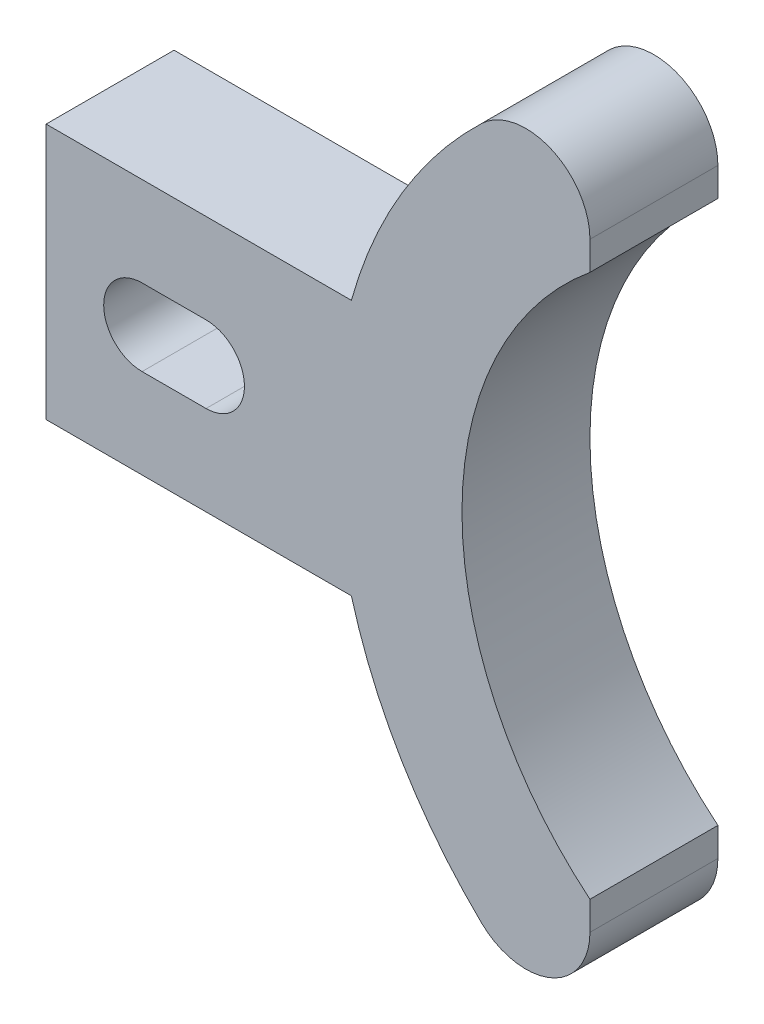
from build123d import *

# Parameters (mm, degrees)
SKETCH1_R           = 3.81
BOSS_EXTRUDE1_DEPTH = 12.7
SKETCH5_W           = 136.177702976
SKETCH5_H           = 134.894748865
CUT_EXTRUDE2_DEPTH  = 82.624584925
FILLET2_R           = 6.35
CUT_EXTRUDE3_DEPTH  = 74.887508158


with BuildPart() as part:
    # Sketch1 → Boss-Extrude1 (new body)
    with BuildSketch(Plane.XY):
        with BuildLine():
            Line((0, 25.4), (0, 0))
            Line((0, 0), (30.299557464, 0))
            ThreePointArc((30.299557464, 0), (44.893679727, -23.189482247), (69.85, -34.499768273))
            Line((69.85, -34.499768273), (69.85, -21.642875899))
            ThreePointArc((69.85, -21.642875899), (41.275, 12.7), (69.85, 47.042875899))
            Line((69.85, 47.042875899), (69.85, 59.899768273))
            ThreePointArc((69.85, 59.899768273), (44.893679727, 48.589482247), (30.299557464, 25.4))
            Line((30.299557464, 25.4), (0, 25.4))
        make_face()
        with Locations((12.7, 12.7)):
            Circle(SKETCH1_R, mode=Mode.SUBTRACT)
    extrude(amount=BOSS_EXTRUDE1_DEPTH)

    # Sketch5 → Cut-Extrude2 (cut, through all)
    with BuildSketch(Plane(origin=(53.975, 0, 0), x_dir=(0, 0, -1), z_dir=(1, 0, 0))):
        with Locations((5.326430662, 6.052825646)):
            Rectangle(SKETCH5_W, SKETCH5_H)
    extrude(amount=CUT_EXTRUDE2_DEPTH, mode=Mode.SUBTRACT)

    # Fillet2
    fillet2_edges = [part.edges().sort_by_distance(p)[0] for p in [
        (53.975, -29.421134838, 6.35),
        (53.975, 54.821134838, 6.35),
    ]]
    fillet(fillet2_edges, radius=FILLET2_R)

    # Sketch6 → Cut-Extrude3 (cut, through all)
    with BuildSketch(Plane(origin=(0, 0, 0), x_dir=(-1, 0, 0), z_dir=(0, 0, -1))):
        with BuildLine():
            Line((-15.875, 16.51), (-9.525, 16.51))
            ThreePointArc((-9.525, 16.51), (-5.715, 12.7), (-9.525, 8.89))
            Line((-9.525, 8.89), (-15.875, 8.89))
            ThreePointArc((-15.875, 8.89), (-19.685, 12.7), (-15.875, 16.51))
        make_face()
    extrude(amount=-CUT_EXTRUDE3_DEPTH, mode=Mode.SUBTRACT)


solid = part.part
